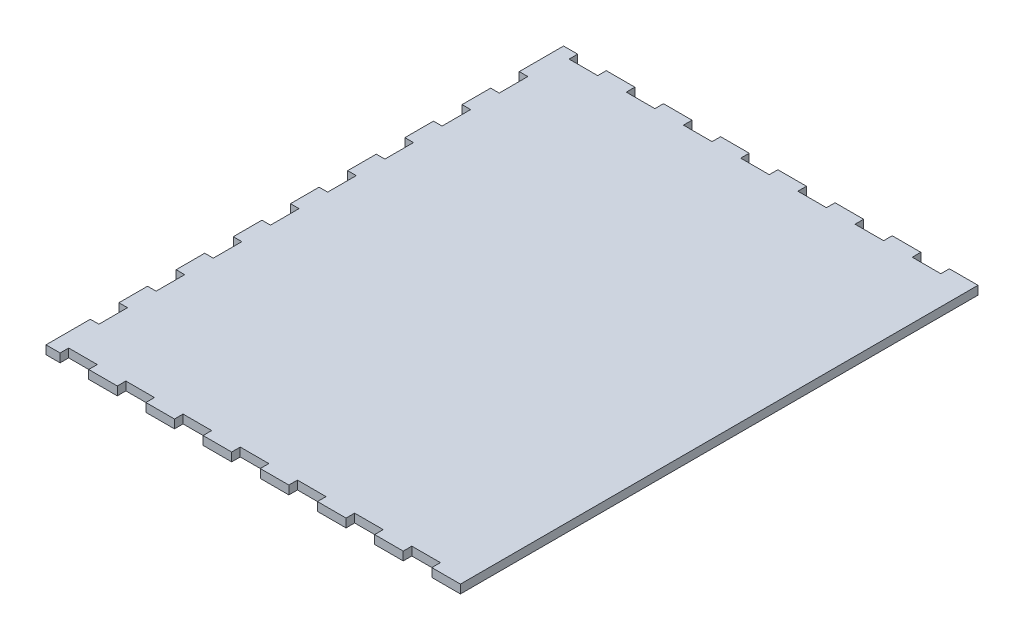
from build123d import *

# Parameters (mm, degrees)
BOSS_EXTRUDE1_DEPTH = 3


with BuildPart() as part:
    # Sketch1 → Boss-Extrude1 (new body)
    with BuildSketch(Plane(origin=(0, 0, 0), x_dir=(1, 0, 0), z_dir=(0, 1, 0))):
        Polygon((0, 0), (0, 15.5), (3, 15.5), (3, 25.5), (0, 25.5), (0, 35.5), (3, 35.5), (3, 45.5), (0, 45.5), (0, 55.5), (3, 55.5), (3, 65.5), (0, 65.5), (0, 75.5), (3, 75.5), (3, 85.5), (0, 85.5), (0, 95.5), (3, 95.5), (3, 105.5), (0, 105.5), (0, 115.5), (3, 115.5), (3, 125.5), (0, 125.5), (0, 135.5), (3, 135.5), (3, 145.5), (0, 145.5), (0, 155.5), (3, 155.5), (3, 165.5), (0, 165.5), (0, 181), (4.93, 181), (4.93, 178), (14.93, 178), (14.93, 181), (24.93, 181), (24.93, 178), (34.93, 178), (34.93, 181), (44.93, 181), (44.93, 178), (54.93, 178), (54.93, 181), (64.93, 181), (64.93, 178), (74.93, 178), (74.93, 181), (84.93, 181), (84.93, 178), (94.93, 178), (94.93, 181), (104.93, 181), (104.93, 178), (114.93, 178), (114.93, 181), (124.93, 181), (124.93, 178), (134.93, 178), (134.93, 181), (144.93, 181), (144.93, 0), (134.93, 0), (134.93, 3), (124.93, 3), (124.93, 0), (114.93, 0), (114.93, 3), (104.93, 3), (104.93, 0), (94.93, 0), (94.93, 3), (84.93, 3), (84.93, 0), (74.93, 0), (74.93, 3), (64.93, 3), (64.93, 0), (54.93, 0), (54.93, 3), (44.93, 3), (44.93, 0), (34.93, 0), (34.93, 3), (24.93, 3), (24.93, 0), (14.93, 0), (14.93, 3), (4.93, 3), (4.93, 0), align=None)
    extrude(amount=BOSS_EXTRUDE1_DEPTH)


solid = part.part
